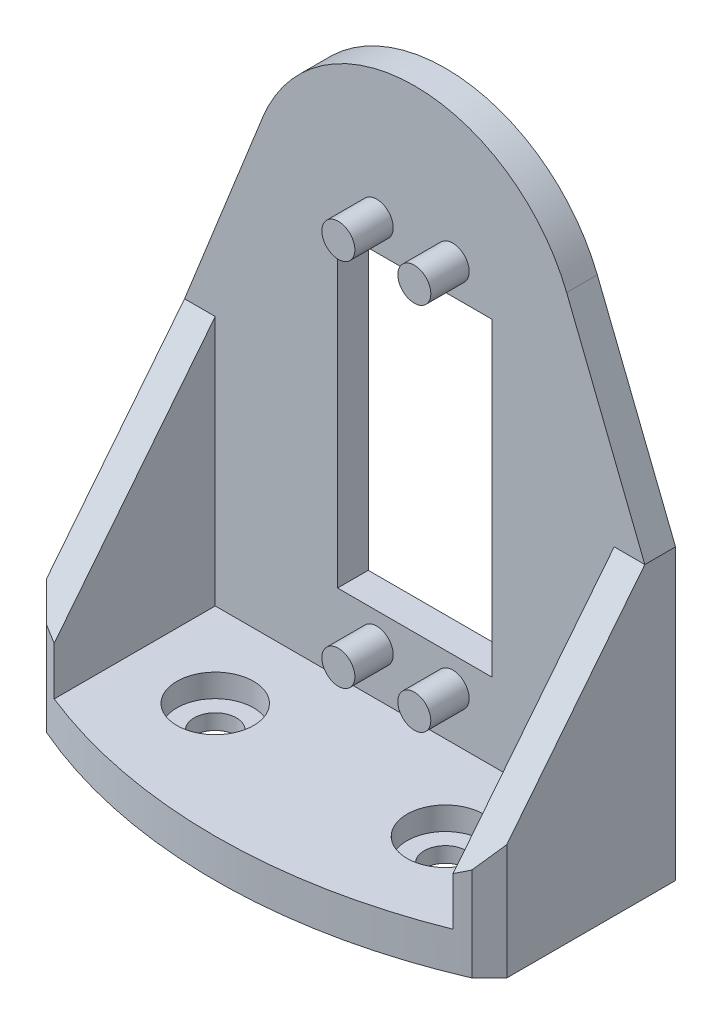
from build123d import *

# Parameters (mm, degrees)
SKETCH1_W                = 120
SKETCH1_H                = 30
BOSS_EXTRUDE1_DEPTH      = 100
CUT_EXTRUDE1_DEPTH       = 121.415945788
CUT_EXTRUDE1_DEPTH_BACK  = 121.415945788
SKETCH2_R                = 2.15
SKETCH2_W                = 20.1
SKETCH2_H                = 40.4
SKETCH3_OUTSIDE_W        = 153.812
SKETCH3_OUTSIDE_H        = 133.812
CUT_EXTRUDE2_DEPTH       = 121.415945788
CUT_EXTRUDE3_START       = -30
CUT_EXTRUDE3_DEPTH       = 30
SKETCH5_W                = 67.698745078
SKETCH5_H                = 100.8
CUT_EXTRUDE4_DEPTH       = 26
RIB1_REACH               = 122.416
SKETCH6_WALL_W           = 284.590065176
SKETCH6_WALL_H           = 4
RIB6_REACH               = 122.416
SKETCH7_WALL_W           = 284.590065176
SKETCH7_WALL_H           = 4
BOSS_EXTRUDE2_DEPTH      = 5
BOSS_EXTRUDE2_DEPTH_BACK = 4
SKETCH8_R                = 2.15
CUT_EXTRUDE5_DEPTH       = 84.326168543
CUT_EXTRUDE5_DEPTH_BACK  = 84.326168543
SKETCH9_R                = 2.75
SKETCH10_R               = 5
CUT_EXTRUDE6_DEPTH       = 3
CHAMFER1_SIZE            = 8
CUT_EXTRUDE7_START       = -12.194246874
CUT_EXTRUDE7_DEPTH       = 12.194246874


# Read off the part's stored shape, not the designer's step: Cut-Extrude3, Cut-Extrude7
with BuildPart() as part:
    # Sketch1 → Boss-Extrude1 (new body)
    with BuildSketch(Plane(origin=(0, 0, 0), x_dir=(1, 0, 0), z_dir=(0, 1, 0))):
        with Locations((0, -15)):
            Rectangle(SKETCH1_W, SKETCH1_H)
    extrude(amount=BOSS_EXTRUDE1_DEPTH)

    # Sketch2 → Cut-Extrude1 (cut, two sides: drawn at the far end of the back side and taken through both)
    with BuildSketch(Plane.XY.offset(30).offset(-CUT_EXTRUDE1_DEPTH_BACK)):
        with Locations((-4.95, 82.583541889)):
            Circle(SKETCH2_R)
        with Locations((4.95, 82.583541889)):
            Circle(SKETCH2_R)
        with Locations((-4.95, 34.383541889)):
            Circle(SKETCH2_R)
        with Locations((4.95, 34.383541889)):
            Circle(SKETCH2_R)
        with Locations((0, 58.483541889)):
            Rectangle(SKETCH2_W, SKETCH2_H)
    extrude(amount=CUT_EXTRUDE1_DEPTH + CUT_EXTRUDE1_DEPTH_BACK, mode=Mode.SUBTRACT)

    # Sketch3 outside → Cut-Extrude2 (cut, through all)
    with BuildSketch(Plane.XY.offset(30)):
        with Locations((0, 50)):
            Rectangle(SKETCH3_OUTSIDE_W, SKETCH3_OUTSIDE_H)
        with BuildLine():
            Line((-45, 23.283541889), (45, 23.283541889))
            Line((45, 23.283541889), (19.804596008, 86.568297014))
            ThreePointArc((19.804596008, 86.568297014), (0, 100), (-19.804596008, 86.568297014))
            Line((-19.804596008, 86.568297014), (-45, 23.283541889))
        make_face(mode=Mode.SUBTRACT)
    extrude(amount=-CUT_EXTRUDE2_DEPTH, mode=Mode.SUBTRACT)

    # Cut-Extrude3 outline → Cut-Extrude3 (cut)
    with BuildSketch(Plane.XY.offset(30).offset(CUT_EXTRUDE3_START)):
        Polygon((30, 60.95991045), (30, 23.283541889), (45, 23.283541889), align=None)
        Polygon((-30, 23.283541889), (-30, 60.95991045), (-45, 23.283541889), align=None)
    extrude(amount=CUT_EXTRUDE3_DEPTH, mode=Mode.SUBTRACT)

    # Sketch5 → Cut-Extrude4 (cut)
    with BuildSketch(Plane.XY.offset(30)):
        with Locations((0, 78.683541889)):
            Rectangle(SKETCH5_W, SKETCH5_H)
    extrude(amount=-CUT_EXTRUDE4_DEPTH, mode=Mode.SUBTRACT)

    # Sketch6 wall → Rib1 (add, up to next)
    with BuildSketch(Plane(origin=(-30, 44.62172617, 17), x_dir=(0, -0.782514313837, 0.622632595228), z_dir=(0, 0.622632595228, 0.782514313837)), mode=Mode.PRIVATE) as rib1_sk1:
        with Locations((0, 2)):
            Rectangle(SKETCH6_WALL_W, SKETCH6_WALL_H)
    rib1_tool1 = extrude(rib1_sk1.sketch, amount=-RIB1_REACH, mode=Mode.PRIVATE) - part.part
    add(rib1_tool1.solids().sort_by_distance((-30, 44.62172617, 17))[0])

    # Sketch7 wall → Rib6 (add, up to next)
    with BuildSketch(Plane(origin=(30, 44.62172617, 17), x_dir=(0, -0.782514313837, 0.622632595228), z_dir=(0, -0.622632595228, -0.782514313837)), mode=Mode.PRIVATE) as rib6_sk1:
        with Locations((0, 2)):
            Rectangle(SKETCH7_WALL_W, SKETCH7_WALL_H)
    rib6_tool1 = extrude(rib6_sk1.sketch, amount=RIB6_REACH, mode=Mode.PRIVATE) - part.part
    add(rib6_tool1.solids().sort_by_distance((30, 44.62172617, 17))[0])

    # Sketch8 → Boss-Extrude2 (add, two sides: drawn at the far end of the back side and taken through both)
    with BuildSketch(Plane.XY.offset(4).offset(-BOSS_EXTRUDE2_DEPTH_BACK)):
        with Locations((-4.95, 82.583541889)):
            Circle(SKETCH8_R)
        with Locations((4.95, 82.583541889)):
            Circle(SKETCH8_R)
        with Locations((-4.95, 34.383541889)):
            Circle(SKETCH8_R)
        with Locations((4.95, 34.383541889)):
            Circle(SKETCH8_R)
    extrude(amount=BOSS_EXTRUDE2_DEPTH + BOSS_EXTRUDE2_DEPTH_BACK)

    # Sketch9 → Cut-Extrude5 (cut, two sides: drawn at the far end of the back side and taken through both)
    with BuildSketch(Plane(origin=(0, 28.283541889, 0), x_dir=(1, 0, 0), z_dir=(0, 1, 0)).offset(-CUT_EXTRUDE5_DEPTH_BACK)):
        with Locations(Location((-15, -15, 0), (0, 0, 270))):
            Circle(SKETCH9_R)
        with Locations(Location((15, -15, 0), (0, 0, 270))):
            Circle(SKETCH9_R)
    extrude(amount=CUT_EXTRUDE5_DEPTH + CUT_EXTRUDE5_DEPTH_BACK, mode=Mode.SUBTRACT)

    # Sketch10 → Cut-Extrude6 (cut)
    with BuildSketch(Plane(origin=(0, 28.283541889, 0), x_dir=(1, 0, 0), z_dir=(0, 1, 0))):
        with Locations(Location((-15, -15, 0), (0, 0, 270))):
            Circle(SKETCH10_R)
        with Locations(Location((15, -15, 0), (0, 0, 270))):
            Circle(SKETCH10_R)
    extrude(amount=-CUT_EXTRUDE6_DEPTH, mode=Mode.SUBTRACT)

    # Chamfer1
    # the kernel refuses this chamfer: 8 mm, written as the material it takes off along each edge
    with BuildSketch(Plane(origin=(-30, 2.710077985, 30), x_dir=(-0.02749587661058658, 0, -0.9996219169112968), z_dir=(0, 1, 0))) as chamfer1_piece_1:
        Polygon((CHAMFER1_SIZE * 0.999621916911, -CHAMFER1_SIZE * 0.0274958766106), (-CHAMFER1_SIZE * 0.0274958766106, -CHAMFER1_SIZE * 0.999621916911), (0, 0), align=None)
    extrude(amount=46.146927807, mode=Mode.SUBTRACT)
    with BuildSketch(Plane(origin=(30, 48.857005793, 30), x_dir=(-0.9996219169112968, 0, 0.027495876610586487), z_dir=(0, -1, 0))) as chamfer1_piece_2:
        Polygon((CHAMFER1_SIZE * 0.999621916911, CHAMFER1_SIZE * 0.0274958766106), (-CHAMFER1_SIZE * 0.0274958766106, CHAMFER1_SIZE * 0.999621916911), (0, 0), align=None)
    extrude(amount=46.146927807, mode=Mode.SUBTRACT)

    # Cut-Extrude7 outline → Cut-Extrude7 (cut)
    with BuildSketch(Plane.XZ.offset(-23.283541889).offset(CUT_EXTRUDE7_START)):
        with BuildLine():
            ThreePointArc((-27.724333118, 24.275666882), (-14.154563191, 28.553981218), (0, 30))
            Line((0, 30), (-22, 30))
            Line((-22, 30), (-27.724333118, 24.275666882))
        make_face()
        with BuildLine():
            ThreePointArc((0, 30), (14.154563191, 28.553981218), (27.724333118, 24.275666882))
            Line((27.724333118, 24.275666882), (22, 30))
            Line((22, 30), (0, 30))
        make_face()
    extrude(amount=CUT_EXTRUDE7_DEPTH, mode=Mode.SUBTRACT)


solid = part.part
